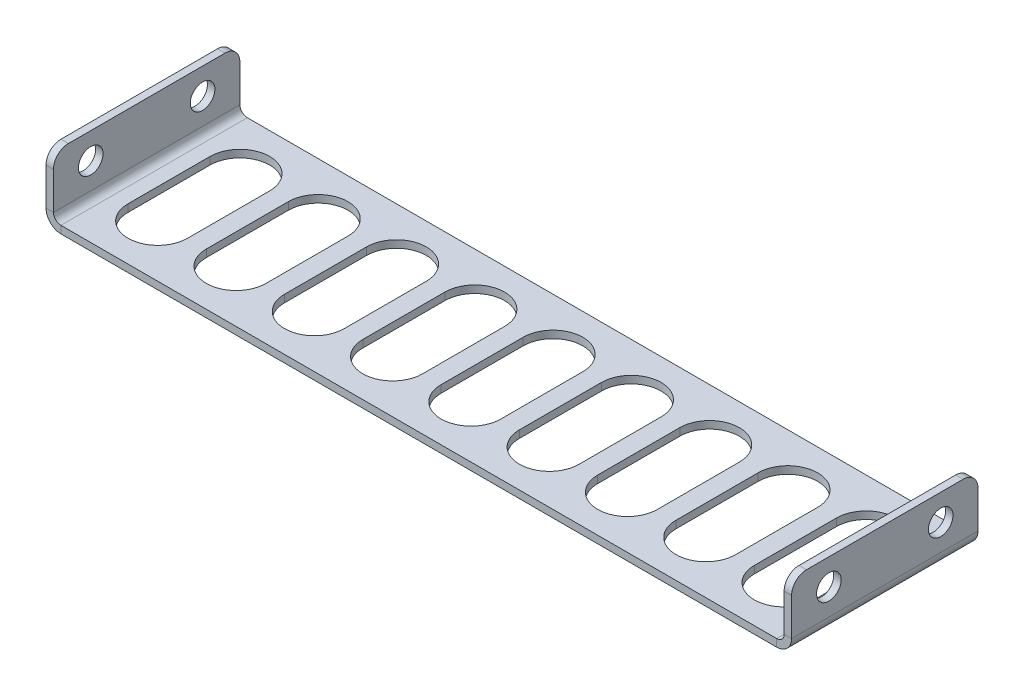
from build123d import *

# Parameters (mm, degrees)
SM_BASE_FLANGE_1_DEPTH   = 12.5
CUT_EXTRUDE_1_DEPTH      = 53.156015952
CUT_EXTRUDE_1_DEPTH_BACK = 53.156015952
SKETCH_6_R               = 1.65
CUT_EXTRUDE_2_DEPTH      = 10
FILLET_1_R               = 2


# Sheet-metal steps are written as plain solids
with BuildPart() as part:
    # Sketch 1 → 基体-法兰1 (new, symmetric)
    with BuildSketch(Plane.XY):
        with BuildLine():
            Line((-49, 8), (-49, 1))
            ThreePointArc((-49, 1), (-48.707106781, 0.292893219), (-48, 0))
            Line((-48, 0), (48, 0))
            ThreePointArc((48, 0), (48.707106781, 0.292893219), (49, 1))
            Line((49, 1), (49, 8))
            Line((49, 8), (50, 8))
            Line((50, 8), (50, 1))
            ThreePointArc((50, 1), (49.414213562, -0.414213562), (48, -1))
            Line((48, -1), (-48, -1))
            ThreePointArc((-48, -1), (-49.414213562, -0.414213562), (-50, 1))
            Line((-50, 1), (-50, 8))
            Line((-50, 8), (-49, 8))
        make_face()
    extrude(amount=SM_BASE_FLANGE_1_DEPTH, both=True)

    # 草图6 → 切除-拉伸1 (cut, two sides: drawn at the far end of the back side and taken through both)
    with BuildSketch(Plane(origin=(0, 0, 0), x_dir=(0, 0, -1), z_dir=(1, 0, 0)).offset(-CUT_EXTRUDE_1_DEPTH_BACK)):
        with Locations((-7.5, 4.5)):
            Circle(SKETCH_6_R)
        with Locations((7.5, 4.5)):
            Circle(SKETCH_6_R)
    extrude(amount=CUT_EXTRUDE_1_DEPTH + CUT_EXTRUDE_1_DEPTH_BACK, mode=Mode.SUBTRACT)

    # 草图7 → 切除-拉伸2 (cut)
    with BuildSketch(Plane.XZ.offset(1)):
        with BuildLine():
            Line((46, 5.5), (46, -5.5))
            ThreePointArc((46, -5.5), (42, -9.5), (38, -5.5))
            Line((38, -5.5), (38, 5.5))
            ThreePointArc((38, 5.5), (42, 9.5), (46, 5.5))
        make_face()
        with BuildLine():
            Line((-38, 5.5), (-38, -5.5))
            ThreePointArc((-38, -5.5), (-42, -9.5), (-46, -5.5))
            Line((-46, -5.5), (-46, 5.5))
            ThreePointArc((-46, 5.5), (-42, 9.5), (-38, 5.5))
        make_face()
        with BuildLine():
            Line((-27.5, 5.5), (-27.5, -5.5))
            ThreePointArc((-27.5, -5.5), (-31.5, -9.5), (-35.5, -5.5))
            Line((-35.5, -5.5), (-35.5, 5.5))
            ThreePointArc((-35.5, 5.5), (-31.5, 9.5), (-27.5, 5.5))
        make_face()
        with BuildLine():
            Line((-17, 5.5), (-17, -5.5))
            ThreePointArc((-17, -5.5), (-21, -9.5), (-25, -5.5))
            Line((-25, -5.5), (-25, 5.5))
            ThreePointArc((-25, 5.5), (-21, 9.5), (-17, 5.5))
        make_face()
        with BuildLine():
            Line((-6.5, 5.5), (-6.5, -5.5))
            ThreePointArc((-6.5, -5.5), (-10.5, -9.5), (-14.5, -5.5))
            Line((-14.5, -5.5), (-14.5, 5.5))
            ThreePointArc((-14.5, 5.5), (-10.5, 9.5), (-6.5, 5.5))
        make_face()
        with BuildLine():
            Line((4, 5.5), (4, -5.5))
            ThreePointArc((4, -5.5), (0, -9.5), (-4, -5.5))
            Line((-4, -5.5), (-4, 5.5))
            ThreePointArc((-4, 5.5), (0, 9.5), (4, 5.5))
        make_face()
        with BuildLine():
            Line((14.5, 5.5), (14.5, -5.5))
            ThreePointArc((14.5, -5.5), (10.5, -9.5), (6.5, -5.5))
            Line((6.5, -5.5), (6.5, 5.5))
            ThreePointArc((6.5, 5.5), (10.5, 9.5), (14.5, 5.5))
        make_face()
        with BuildLine():
            Line((25, 5.5), (25, -5.5))
            ThreePointArc((25, -5.5), (21, -9.5), (17, -5.5))
            Line((17, -5.5), (17, 5.5))
            ThreePointArc((17, 5.5), (21, 9.5), (25, 5.5))
        make_face()
        with BuildLine():
            Line((35.5, 5.5), (35.5, -5.5))
            ThreePointArc((35.5, -5.5), (31.5, -9.5), (27.5, -5.5))
            Line((27.5, -5.5), (27.5, 5.5))
            ThreePointArc((27.5, 5.5), (31.5, 9.5), (35.5, 5.5))
        make_face()
    extrude(amount=-CUT_EXTRUDE_2_DEPTH, mode=Mode.SUBTRACT)

    # 圆角1
    fillet_1_edges = [part.edges().sort_by_distance(p)[0] for p in [
        (-49.5, 8, -12.5),
        (49.5, 8, -12.5),
        (-49.5, 8, 12.5),
        (49.5, 8, 12.5),
    ]]
    fillet(fillet_1_edges, radius=FILLET_1_R)


solid = part.part
